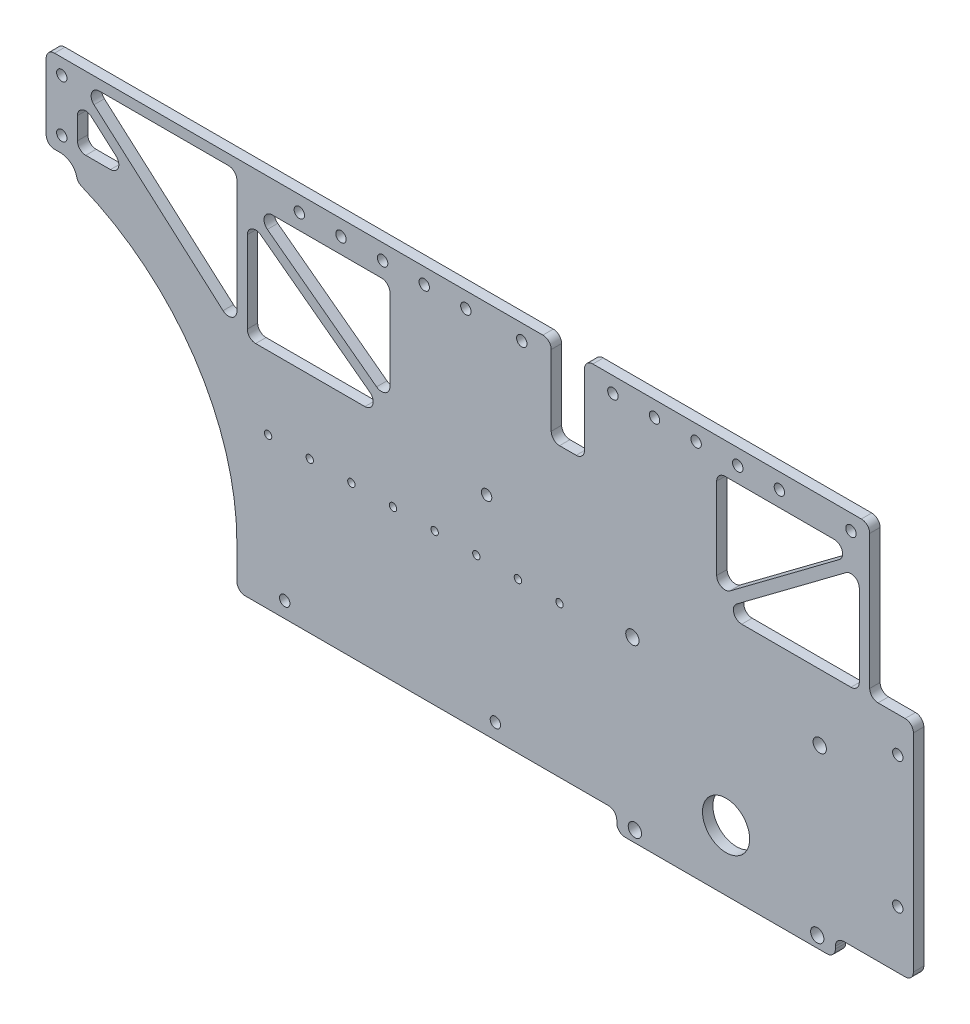
from build123d import *

# Parameters (mm, degrees)
SKETCH1_W            = 635
SKETCH1_H            = 136.525
SKETCH1_R            = 14.3891
BOSS_EXTRUDE1_DEPTH  = 6.35
SKETCH2_R            = 3.175
CUT_EXTRUDE1_DEPTH   = 325.817397019
SKETCH3_5_R          = 3.175
BOSS_EXTRUDE5_DEPTH  = 6.35
SKETCH4_W            = 40.57142
SKETCH4_H            = 44.2976
SKETCH4_R            = 4.064
SKETCH4_W_2          = 133.35
SKETCH4_H_2          = 18.0086
SKETCH4_W_3          = 18.415
SKETCH4_H_3          = 20.828
BOSS_EXTRUDE7_DEPTH  = 6.35
SKETCH5_R            = 4.064
SKETCH5_R_2          = 4.06539538
CUT_EXTRUDE3_DEPTH   = 328.465959643
FILLET1_R            = 5.08
FILLET2_R            = 3.175
SKETCH3_R            = 3.175
CUT_EXTRUDE4_DEPTH   = 328.465959643
FILLET4_R            = 3.175
SKETCH6_W            = 18.557078118
SKETCH6_H            = 39.949187225
BOSS_EXTRUDE8_DEPTH  = 6.35
SKETCH7_W            = 222.25
SKETCH7_H            = 154.673472586
CUT_EXTRUDE5_DEPTH   = 328.465959643
SKETCH8_W            = 6.35
SKETCH8_H            = 136.525
BOSS_EXTRUDE9_DEPTH  = 6.35
FILLET5_R            = 5.08
SKETCH9_R            = 3.175
BOSS_EXTRUDE10_DEPTH = 6.35
SKETCH10_R           = 3.175
CUT_EXTRUDE6_DEPTH   = 356.745254931
BOSS_EXTRUDE14_DEPTH = 6.35
BOSS_EXTRUDE16_DEPTH = 6.35
SKETCH12_W           = 15.83351873
SKETCH12_H           = 14.417925857
SKETCH12_W_2         = 19.64182
SKETCH12_H_2         = 108.78964543
SKETCH12_W_3         = 69.679335665
SKETCH12_H_3         = 12.817560459
SKETCH12_H_4         = 7.518606915
SKETCH12_W_4         = 6.576544335
SKETCH12_H_5         = 103.488832626
SKETCH12_W_5         = 3.175
SKETCH12_H_6         = 20.828
SKETCH12_W_6         = 5.08
SKETCH12_H_7         = 5.08
BOSS_EXTRUDE17_DEPTH = 6.35
SKETCH13_R           = 3.175
CUT_EXTRUDE7_DEPTH   = 356.745254931
CUT_EXTRUDE8_DEPTH   = 356.745254931
SKETCH15_W           = 20.32
SKETCH15_H           = 53.34
SKETCH15_W_2         = 79.983851964
SKETCH15_H_2         = 50.8
CUT_EXTRUDE9_DEPTH   = 356.745254931
FILLET8_R            = 5.08
SKETCH17_R           = 2.2479
CUT_EXTRUDE10_DEPTH  = 356.745255068


with BuildPart() as part:
    # Sketch1 → Boss-Extrude1 (new body)
    with BuildSketch(Plane.XY):
        Rectangle(SKETCH1_W, SKETCH1_H)
        with Locations((203.2, -42.8625)):
            Circle(SKETCH1_R, mode=Mode.SUBTRACT)
        with Locations((-206.82458, -42.8625)):
            Circle(SKETCH1_R, mode=Mode.SUBTRACT)
    extrude(amount=BOSS_EXTRUDE1_DEPTH)

    # Sketch2 → Cut-Extrude1 (cut, through all)
    with BuildSketch(Plane.XY.offset(6.35)):
        Polygon((-69.25818, -61.9125), (-186.08548, 53.005329912), (-186.08548, -61.9125), align=None)
        Polygon((-69.25818, 61.9125), (-186.08548, 61.9125), (-69.25818, -53.005329912), align=None)
        Polygon((-62.90818, -61.9125), (53.91912, -61.9125), (53.91912, 53.005329912), align=None)
        Polygon((53.91912, 61.9125), (-62.90818, 61.9125), (-62.90818, -53.005329912), align=None)
        Polygon((177.09642, -61.9125), (60.26912, 53.005329912), (60.26912, -61.9125), align=None)
        Polygon((177.09642, 61.9125), (60.26912, 61.9125), (177.09642, -53.005329912), align=None)
        with BuildLine():
            Line((257.81, -23.8125), (311.15, -23.8125))
            Line((311.15, -23.8125), (311.15, 37.823747319))
            ThreePointArc((311.15, 37.823747319), (306.727584277, 37.361038915), (302.577018199, 38.956238314))
            Line((302.577018199, 38.956238314), (257.81, -23.8125))
        make_face()
        with BuildLine():
            Line((306.218636269, 61.9125), (257.81, 61.9125))
            Line((257.81, 61.9125), (257.81, -12.876588851))
            Line((257.81, -12.876588851), (298.732456161, 44.501611558))
            ThreePointArc((298.732456161, 44.501611558), (299.949387671, 51.933834991), (306.183684914, 56.159045677))
            ThreePointArc((306.183684914, 56.159045677), (307.077151231, 56.515606037), (307.773939777, 57.17885793))
            Line((307.773939777, 57.17885793), (308.286575154, 57.897634323))
            ThreePointArc((308.286575154, 57.897634323), (308.47670611, 60.53556517), (306.218636269, 61.9125))
        make_face()
        Polygon((251.46, -12.876588851), (251.46, 61.9125), (206.848115361, 61.9125), align=None)
        Polygon((-311.15, -61.9125), (-227.56368, -61.9125), (-227.56368, 51.22616393), align=None)
        with BuildLine():
            ThreePointArc((-311.15, -13.414003587), (-302.592520369, -25.241870273), (-288.681380576, -20.813656454))
            Line((-288.681380576, -20.813656454), (-227.56368, 61.9125))
            Line((-227.56368, 61.9125), (-298.45, 61.9125))
            Line((-298.45, 61.9125), (-298.45, 46.80400344))
            ThreePointArc((-298.45, 46.80400344), (-302.475738686, 39.026873506), (-311.15, 37.823747319))
            Line((-311.15, 37.823747319), (-311.15, -13.414003587))
        make_face()
        with Locations((-307.975, -33.3375)):
            Circle(SKETCH2_R)
        with Locations((307.975, -33.3375)):
            Circle(SKETCH2_R)
        with Locations((-307.975, 46.80400344)):
            Circle(SKETCH2_R)
        with Locations((307.975, 46.80400344)):
            Circle(SKETCH2_R)
    extrude(amount=-CUT_EXTRUDE1_DEPTH, mode=Mode.SUBTRACT)

    # Sketch3<5> → Boss-Extrude5 (add)
    with BuildSketch(Plane.XY.offset(6.35)):
        with BuildLine():
            ThreePointArc((52.9336, -58.7375), (62.4586, -49.2125), (71.9836, -58.7375))
            Line((71.9836, -58.7375), (71.9836, -68.2625))
            Line((71.9836, -68.2625), (52.9336, -68.2625))
            Line((52.9336, -68.2625), (52.9336, -58.7375))
        make_face()
        with Locations((62.4586, -58.7375)):
            Circle(SKETCH3_5_R, mode=Mode.SUBTRACT)
    extrude(amount=-BOSS_EXTRUDE5_DEPTH)

    # Sketch4 → Boss-Extrude7 (add, through all)
    # profile 1 of 3: a face of its own
    with BuildSketch(Plane.XY.offset(6.35)):
        with Locations((156.81071, 39.7637)):
            Rectangle(SKETCH4_W, SKETCH4_H)
        with Locations((146.05, 28.0289)):
            Circle(SKETCH4_R, mode=Mode.SUBTRACT)
    # profile 2 of 3: a face of its own
    with BuildSketch(Plane.XY.offset(6.35)):
        with Locations((203.2, -70.9168)):
            Rectangle(SKETCH4_W_2, SKETCH4_H_2)
        with Locations((147.574, -73.0631)):
            Circle(SKETCH4_R, mode=Mode.SUBTRACT)
        with Locations((258.826, -73.0631)):
            Circle(SKETCH4_R, mode=Mode.SUBTRACT)
    # profile 3 of 3: a face of its own
    with BuildSketch(Plane.XY.offset(6.35)):
        with Locations((260.6675, 28.0289)):
            Rectangle(SKETCH4_W_3, SKETCH4_H_3)
        with Locations((260.35, 28.0289)):
            Circle(SKETCH4_R, mode=Mode.SUBTRACT)
    extrude(amount=-BOSS_EXTRUDE7_DEPTH)

    # Sketch5 → Cut-Extrude3 (cut, through all)
    with BuildSketch(Plane.XY.offset(6.35)):
        with Locations((146.05, 28.0289)):
            Circle(SKETCH5_R)
        with Locations((260.35, 28.0289)):
            Circle(SKETCH5_R_2)
    extrude(amount=-CUT_EXTRUDE3_DEPTH, mode=Mode.SUBTRACT)

    # Fillet1
    # the kernel refuses this fillet: 5.08 mm, written as the material it adds along each edge
    with BuildSketch(Plane(origin=(206.848115361, 61.9125, 6.35), x_dir=(0.512285493474542, -0.8588152148020813, 0), z_dir=(0, 0, -1))) as fillet1_piece_1:
        with BuildLine():
            CenterArc((FILLET1_R * 1.76089741706, -FILLET1_R), FILLET1_R, 90, 120.816185582)
            Line((FILLET1_R * 0.902082202255, -FILLET1_R * 1.51228549347), (0, 0))
            Line((0, 0), (FILLET1_R * 1.76089741706, 0))
        make_face()
    extrude(amount=6.35)
    with BuildSketch(Plane(origin=(251.46, 61.9125, 6.35), x_dir=(0, -1, 0), z_dir=(0, 0, -1)), Plane(origin=(257.81, 61.9125, 6.35), x_dir=(1, 0, 0), z_dir=(0, 0, -1)), Plane(origin=(136.525, 61.9125, 6.35), x_dir=(0, -1, 0), z_dir=(0, 0, -1)), Plane(origin=(177.09642, 17.6149, 6.35), x_dir=(0, -1, 0), z_dir=(0, 0, -1)), Plane(origin=(-227.56368, -61.9125, 6.35), x_dir=(-1, 0, 0), z_dir=(0, 0, -1)), Plane(origin=(-186.08548, -61.9125, 6.35), x_dir=(0, 1, 0), z_dir=(0, 0, -1)), Plane(origin=(-62.90818, 61.9125, 6.35), x_dir=(1, 0, 0), z_dir=(0, 0, -1))) as fillet1_piece_2:
        with BuildLine():
            CenterArc((FILLET1_R, FILLET1_R), FILLET1_R, 180, 90)
            Line((0, FILLET1_R), (0, 0))
            Line((0, 0), (FILLET1_R, 0))
        make_face()
    extrude(amount=6.35)
    with BuildSketch(Plane(origin=(251.46, -12.876588851, 6.35), x_dir=(0, 1, 0), z_dir=(0, 0, -1))) as fillet1_piece_3:
        with BuildLine():
            CenterArc((FILLET1_R * 3.62847521251, -FILLET1_R), FILLET1_R, 90, 149.183814418)
            Line((FILLET1_R * 3.11618971904, -FILLET1_R * 1.8588152148), (0, 0))
            Line((0, 0), (FILLET1_R * 3.62847521251, 0))
        make_face()
    extrude(amount=6.35)
    with BuildSketch(Plane(origin=(298.732456161, 44.501611558, 6.35), x_dir=(-0.156449292900934, 0.9876859919786236, 0), z_dir=(0, 0, -1))) as fillet1_piece_4:
        with BuildLine():
            CenterArc((2.097728596, -5.060767287), FILLET1_R, 94.987273308, 39.51026668)
            Line((-1.462734895, -1.437302132), (0, 0))
            ThreePointArc((0, 0), (0.828050762, -0.036061338), (1.656101523, 0))
        make_face()
    extrude(amount=6.35)
    with BuildSketch(Plane(origin=(257.81, -12.876588851, 6.35), x_dir=(0.58065577834663, 0.8141491675808981, 0), z_dir=(0, 0, -1))) as fillet1_piece_5:
        with BuildLine():
            CenterArc((FILLET1_R * 3.12431088303, -FILLET1_R), FILLET1_R, 90, 144.503320177)
            Line((FILLET1_R * 2.54365510468, -FILLET1_R * 1.81414916758), (0, 0))
            Line((0, 0), (FILLET1_R * 3.12431088303, 0))
        make_face()
    extrude(amount=6.35)
    with BuildSketch(Plane(origin=(302.577018199, 38.956238314, 6.35), x_dir=(0.9100185718572312, -0.4145674841023176, 0), z_dir=(0, 0, -1))) as fillet1_piece_6:
        with BuildLine():
            CenterArc((4.202383129, 5.002367865), FILLET1_R, 191.00459797, 68.96585853)
            Line((-0.78420516, 4.032657993), (0, 0))
            ThreePointArc((0, 0), (1.658835446, 0.145560253), (3.317670892, 0))
        make_face()
    extrude(amount=6.35)
    with BuildSketch(Plane(origin=(311.15, 37.823747319, 6.35), x_dir=(-0.9945433078574452, -0.10432453592502183, 0), z_dir=(0, 0, -1))) as fillet1_piece_7:
        with BuildLine():
            CenterArc((5.626062007, -4.939991482), FILLET1_R, 103.482969045, 82.505282546)
            Line((0.573782003, -5.469960125), (0, 0))
            ThreePointArc((0, 0), (2.22081395, -0.26251597), (4.4416279, 0))
        make_face()
    extrude(amount=6.35)
    with BuildSketch(Plane(origin=(311.15, -23.8125, 6.35), x_dir=(0, 1, 0), z_dir=(0, 0, -1)), Plane(origin=(-298.45, 61.9125, 6.35), x_dir=(0, -1, 0), z_dir=(0, 0, -1)), Plane(origin=(136.525, -68.2625, 6.35), x_dir=(-1, 0, 0), z_dir=(0, 0, -1)), Plane(origin=(269.875, -68.2625, 0), x_dir=(1, 0, 0), z_dir=(0, 0, 1)), Plane(origin=(-69.25818, 61.9125, 6.35), x_dir=(-1, 0, 0), z_dir=(0, 0, -1))) as fillet1_piece_8:
        with BuildLine():
            CenterArc((FILLET1_R, -FILLET1_R), FILLET1_R, 90, 90)
            Line((0, -FILLET1_R), (0, 0))
            Line((0, 0), (FILLET1_R, 0))
        make_face()
    extrude(amount=6.35)
    with BuildSketch(Plane(origin=(257.81, -23.8125, 6.35), x_dir=(0.5806557783466294, 0.8141491675808985, 0), z_dir=(0, 0, -1))) as fillet1_piece_9:
        with BuildLine():
            CenterArc((FILLET1_R * 1.94148178404, FILLET1_R), FILLET1_R, 144.503320177, 125.496679823)
            Line((FILLET1_R * 1.12733261646, FILLET1_R * 1.58065577835), (0, 0))
            Line((0, 0), (FILLET1_R * 1.94148178404, 0))
        make_face()
    extrude(amount=6.35)
    with BuildSketch(Plane(origin=(-311.15, 37.823747319, 6.35), x_dir=(0, -1, 0), z_dir=(0, 0, -1))) as fillet1_piece_10:
        with BuildLine():
            CenterArc((5.499971778, -5.08), FILLET1_R, 90, 82.505282546)
            ThreePointArc((0.463370769, -4.417391304), (0.492768886, -2.181308795), (0, 0))
            Line((0, 0), (5.499971778, 0))
        make_face()
    extrude(amount=6.35)
    with BuildSketch(Plane(origin=(-227.56368, 61.9125, 6.35), x_dir=(-0.5942167604191997, -0.8043049431881613, 0), z_dir=(0, 0, -1)), Plane(origin=(-311.15, -61.9125, 6.35), x_dir=(0.5942167604191981, 0.8043049431881626, 0), z_dir=(0, 0, -1))) as fillet1_piece_11:
        with BuildLine():
            CenterArc((FILLET1_R * 1.98210488935, FILLET1_R), FILLET1_R, 143.543183154, 126.456816846)
            Line((FILLET1_R * 1.17779994616, FILLET1_R * 1.59421676042), (0, 0))
            Line((0, 0), (FILLET1_R * 1.98210488935, 0))
        make_face()
    extrude(amount=6.35)
    with BuildSketch(Plane(origin=(71.9836, -61.9125, 6.35), x_dir=(1, 0, 0), z_dir=(0, 0, -1)), Plane(origin=(52.9336, -61.9125, 0), x_dir=(-1, 0, 0), z_dir=(0, 0, 1))) as fillet1_piece_12:
        with BuildLine():
            CenterArc((4.955227899, -5.08), FILLET1_R, 90, 82.505282546)
            Line((-0.08137311, -4.417391304), (-0.58503321, -4.351130435))
            ThreePointArc((-0.58503321, -4.351130435), (-0.508, -3.175), (-0.508, 0))
            Line((-0.508, 0), (0, 0.508))
            Line((0, 0.508), (4.955227899, 0.508))
            Line((4.955227899, 0.508), (4.955227899, 0))
        make_face()
    extrude(amount=6.35)
    with BuildSketch(Plane(origin=(60.26912, -49.467559206, 0), x_dir=(0.9998662412607702, 0.016355414609833863, 0), z_dir=(0, 0, 1))) as fillet1_piece_13:
        with BuildLine():
            CenterArc((5.161852646, 4.962405713), FILLET1_R, 179.062861987, 78.58505404)
            Line((0.08253214, 5.045491219), (0, 0))
            ThreePointArc((0, 0), (2.037573413, 0.220489288), (4.075146826, 0))
        make_face()
    extrude(amount=6.35)
    with BuildSketch(Plane(origin=(-227.56368, 51.22616393, 6.35), x_dir=(-0.5942167604191995, -0.8043049431881615, 0), z_dir=(0, 0, -1))) as fillet1_piece_14:
        with BuildLine():
            CenterArc((FILLET1_R * 3.0364423614, -FILLET1_R), FILLET1_R, 90, 143.543183154)
            Line((FILLET1_R * 2.44222560098, -FILLET1_R * 1.80430494319), (0, 0))
            Line((0, 0), (FILLET1_R * 3.0364423614, 0))
        make_face()
    extrude(amount=6.35)
    with BuildSketch(Plane(origin=(-69.25818, -53.005329912, 6.35), x_dir=(-0.7129088068865802, 0.7012567525974724, 0), z_dir=(0, 0, -1)), Plane(origin=(-186.08548, 53.005329912, 6.35), x_dir=(0.7129088068865791, -0.7012567525974737, 0), z_dir=(0, 0, -1)), Plane(origin=(60.26912, 53.005329912, 6.35), x_dir=(0.7129088068865802, -0.7012567525974724, 0), z_dir=(0, 0, -1)), Plane(origin=(-62.90818, -53.005329912, 6.35), x_dir=(0, 1, 0), z_dir=(0, 0, -1))) as fillet1_piece_15:
        with BuildLine():
            CenterArc((FILLET1_R * 2.38635956824, FILLET1_R), FILLET1_R, 135.472079398, 134.527920602)
            Line((FILLET1_R * 1.67345076135, FILLET1_R * 1.7012567526), (0, 0))
            Line((0, 0), (FILLET1_R * 2.38635956824, 0))
        make_face()
    extrude(amount=6.35)
    with BuildSketch(Plane(origin=(-186.08548, 61.9125, 6.35), x_dir=(1, 0, 0), z_dir=(0, 0, -1)), Plane(origin=(177.09642, -61.9125, 6.35), x_dir=(-1, 0, 0), z_dir=(0, 0, -1))) as fillet1_piece_16:
        with BuildLine():
            CenterArc((FILLET1_R * 2.44262718404, FILLET1_R), FILLET1_R, 134.527920602, 135.472079398)
            Line((FILLET1_R * 1.74137043144, FILLET1_R * 1.71290880689), (0, 0))
            Line((0, 0), (FILLET1_R * 2.44262718404, 0))
        make_face()
    extrude(amount=6.35)
    with BuildSketch(Plane(origin=(-69.25818, -61.9125, 6.35), x_dir=(-0.7129088068865801, 0.7012567525974727, 0), z_dir=(0, 0, -1)), Plane(origin=(-62.90818, -61.9125, 6.35), x_dir=(1, 0, 0), z_dir=(0, 0, -1)), Plane(origin=(60.26912, 61.9125, 6.35), x_dir=(0.7129088068865803, -0.7012567525974723, 0), z_dir=(0, 0, -1)), Plane(origin=(53.91912, 61.9125, 6.35), x_dir=(-1, 0, 0), z_dir=(0, 0, -1))) as fillet1_piece_17:
        with BuildLine():
            CenterArc((FILLET1_R * 2.44262718404, -FILLET1_R), FILLET1_R, 90, 135.472079398)
            Line((FILLET1_R * 1.74137043144, -FILLET1_R * 1.71290880689), (0, 0))
            Line((0, 0), (FILLET1_R * 2.44262718404, 0))
        make_face()
    extrude(amount=6.35)
    with BuildSketch(Plane(origin=(53.91912, 53.005329912, 6.35), x_dir=(-0.7129088068865802, -0.7012567525974724, 0), z_dir=(0, 0, -1)), Plane(origin=(177.09642, -53.005329912, 6.35), x_dir=(0, 1, 0), z_dir=(0, 0, -1))) as fillet1_piece_18:
        with BuildLine():
            CenterArc((FILLET1_R * 2.38635956824, -FILLET1_R), FILLET1_R, 90, 134.527920602)
            Line((FILLET1_R * 1.67345076135, -FILLET1_R * 1.7012567526), (0, 0))
            Line((0, 0), (FILLET1_R * 2.38635956824, 0))
        make_face()
    extrude(amount=6.35)
    # the kernel refuses this fillet: 5.08 mm, written as the material it takes off along each edge
    with BuildSketch(Plane(origin=(136.525, 17.6149, 19.05), x_dir=(1, 0, 0), z_dir=(0, 0, -1)), Plane(origin=(-317.5, -68.2625, -12.7), x_dir=(0, 1, 0), z_dir=(0, 0, 1)), Plane(origin=(-317.5, 68.2625, -12.7), x_dir=(1, 0, 0), z_dir=(0, 0, 1))) as fillet1_2_piece_1:
        with BuildLine():
            CenterArc((FILLET1_R, -FILLET1_R), FILLET1_R, 90, 90)
            Line((0, -FILLET1_R), (0, 0))
            Line((0, 0), (FILLET1_R, 0))
        make_face()
    extrude(amount=31.75, mode=Mode.SUBTRACT)
    with BuildSketch(Plane(origin=(136.525, -79.9211, 19.05), x_dir=(0, 1, 0), z_dir=(0, 0, -1)), Plane(origin=(269.875, -79.9211, 19.05), x_dir=(-1, 0, 0), z_dir=(0, 0, -1)), Plane(origin=(317.5, -68.2625, -12.7), x_dir=(0, 1, 0), z_dir=(0, 0, 1))) as fillet1_2_piece_2:
        with BuildLine():
            CenterArc((FILLET1_R, FILLET1_R), FILLET1_R, 180, 90)
            Line((0, FILLET1_R), (0, 0))
            Line((0, 0), (FILLET1_R, 0))
        make_face()
    extrude(amount=31.75, mode=Mode.SUBTRACT)

    # Fillet2
    fillet2_edges = [part.edges().sort_by_distance(p)[0] for p in [
        (257.81, 38.4429, 3.175),
        (257.81, 17.6149, 3.175),
    ]]
    fillet(fillet2_edges, radius=FILLET2_R)

    # Sketch3 → Cut-Extrude4 (cut, through all)
    with BuildSketch(Plane.XY.offset(6.35)):
        with Locations((-66.08318, -58.7375)):
            Circle(SKETCH3_R)
        with BuildLine():
            ThreePointArc((60.26912, -61.036804749), (63.709404941, -61.655737824), (65.6336, -58.7375))
            ThreePointArc((65.6336, -58.7375), (63.709404941, -55.819262176), (60.26912, -56.438195251))
            Line((60.26912, -56.438195251), (60.26912, -61.036804749))
        make_face()
        with BuildLine():
            Line((60.26912, -61.036804749), (60.26912, -56.438195251))
            ThreePointArc((60.26912, -56.438195251), (59.2836, -58.7375), (60.26912, -61.036804749))
        make_face()
    extrude(amount=-CUT_EXTRUDE4_DEPTH, mode=Mode.SUBTRACT)

    # Fillet4
    fillet4_edges = [part.edges().sort_by_distance(p)[0] for p in [
        (269.875, 17.6149, 3.175),
        (269.875, 38.4429, 3.175),
    ]]
    fillet(fillet4_edges, radius=FILLET4_R)

    # Sketch6 → Boss-Extrude8 (add)
    with BuildSketch(Plane.XY.offset(6.35)):
        with Locations((191.663943851, 44.016225807)):
            Rectangle(SKETCH6_W, SKETCH6_H)
    extrude(amount=-BOSS_EXTRUDE8_DEPTH)

    # Sketch7 → Cut-Extrude5 (cut, through all)
    with BuildSketch(Plane.XY.offset(6.35)):
        with Locations((-206.375, 5.039646722)):
            Rectangle(SKETCH7_W, SKETCH7_H)
    extrude(amount=-CUT_EXTRUDE5_DEPTH, mode=Mode.SUBTRACT)

    # Sketch8 → Boss-Extrude9 (add)
    with BuildSketch(Plane.XY.offset(6.35)):
        with Locations((-92.075, 0)):
            Rectangle(SKETCH8_W, SKETCH8_H)
    extrude(amount=-BOSS_EXTRUDE9_DEPTH)

    # Fillet5
    fillet5_edges = [part.edges().sort_by_distance(p)[0] for p in [
        (53.91912, -54.518150959, 3.175),
        (-95.25, -68.2625, 3.175),
        (-88.9, 61.9125, 3.175),
        (-88.9, -61.9125, 3.175),
        (-88.9, -42.591713421, 3.175),
        (-88.9, -33.684543333, 3.175),
    ]]
    fillet(fillet5_edges, radius=FILLET5_R)

    # Sketch9 → Boss-Extrude10 (add)
    with BuildSketch(Plane.XY.offset(6.35)):
        Polygon((-95.25, 160.3375), (-95.25, 68.2625), (-88.9, 68.2625), (-88.9, 133.356656075), (-1.905, 68.2625), (197.485, 68.2625), (284.48, 133.356656075), (284.48, 68.2625), (290.83, 68.2625), (290.83, 160.3375), align=None)
        Polygon((-1.905, 76.193343925), (-88.9, 141.2875), (-1.905, 141.2875), align=None, mode=Mode.SUBTRACT)
        Polygon((197.485, 76.193343925), (197.485, 141.2875), (284.48, 141.2875), align=None, mode=Mode.SUBTRACT)
        with Locations((-57.15, 150.8125)):
            Circle(SKETCH9_R, mode=Mode.SUBTRACT)
        with Locations((-31.75, 150.8125)):
            Circle(SKETCH9_R, mode=Mode.SUBTRACT)
        with Locations((-6.35, 150.8125)):
            Circle(SKETCH9_R, mode=Mode.SUBTRACT)
        with Locations((19.05, 150.8125)):
            Circle(SKETCH9_R, mode=Mode.SUBTRACT)
        with Locations((44.45, 150.8125)):
            Circle(SKETCH9_R, mode=Mode.SUBTRACT)
        with Locations((279.4, 150.8125)):
            Circle(SKETCH9_R, mode=Mode.SUBTRACT)
    extrude(amount=-BOSS_EXTRUDE10_DEPTH)

    # Sketch10 → Cut-Extrude6 (cut, through all)
    with BuildSketch(Plane.XY.offset(6.35)):
        with Locations((57.09412, 58.7375)):
            Circle(SKETCH10_R)
    extrude(amount=-CUT_EXTRUDE6_DEPTH, mode=Mode.SUBTRACT)

    # Sketch11 → Boss-Extrude14 (add)
    with BuildSketch(Plane(origin=(0, 0, 0), x_dir=(-1, 0, 0), z_dir=(0, 0, -1))):
        with BuildLine():
            Line((291.592, 109.5375), (291.592, 160.3375))
            Line((291.592, 160.3375), (95.25, 160.3375))
            Line((95.25, 160.3375), (95.25, -42.8625))
            ThreePointArc((95.25, -42.8625), (139.886926547, 64.900573453), (247.65, 109.5375))
            Line((247.65, 109.5375), (291.592, 109.5375))
        make_face()
    extrude(amount=-BOSS_EXTRUDE14_DEPTH)

    # Sketch2<3> → Boss-Extrude16 (add)
    with BuildSketch(Plane.XY.offset(6.35)):
        Polygon((-62.90818, 61.9125), (-62.90818, -53.005329912), (53.91912, 61.9125), align=None)
        Polygon((-62.90818, -61.9125), (53.91912, 53.005329912), (53.91912, -61.9125), align=None)
        Polygon((206.848115361, 61.9125), (251.46, 61.9125), (251.46, -12.876588851), align=None)
        with BuildLine():
            ThreePointArc((302.577018199, 38.956238314), (306.727584277, 37.361038915), (311.15, 37.823747319))
            Line((311.15, 37.823747319), (311.15, -23.8125))
            Line((311.15, -23.8125), (257.81, -23.8125))
            Line((257.81, -23.8125), (302.577018199, 38.956238314))
        make_face()
    extrude(amount=-BOSS_EXTRUDE16_DEPTH)

    # Sketch12 → Boss-Extrude17 (add)
    with BuildSketch(Plane.XY.offset(6.35)):
        with Locations((-83.111621925, -55.986936692)):
            Rectangle(SKETCH12_W, SKETCH12_H)
        with Locations((-79.07909, 7.517677285)):
            Rectangle(SKETCH12_W_2, SKETCH12_H_2)
        Polygon((136.525, 49.094939541), (66.845664335, 49.094939541), (66.845664335, -54.393893085), (136.525, -54.393893085), (136.525, 17.6149), (136.525, 22.6949), align=None)
        Polygon((136.525, 17.6149), (136.525, -54.393893085), (136.525, -61.9125), (177.09642, -61.9125), (177.09642, 17.6149), (141.605, 17.6149), align=None)
        with Locations((101.685332168, 55.50371977)):
            Rectangle(SKETCH12_W_3, SKETCH12_H_3)
        with Locations((101.685332168, -58.153196542)):
            Rectangle(SKETCH12_W_3, SKETCH12_H_4)
        with Locations((63.557392168, -2.649476772)):
            Rectangle(SKETCH12_W_4, SKETCH12_H_5)
        Polygon((257.81, 38.4429), (257.81, 61.9125), (311.15, 61.9125), (257.81, -12.876588851), (257.81, 17.6149), (269.875, 17.6149), (269.875, 38.4429), align=None)
        with Locations((268.2875, 28.0289)):
            Rectangle(SKETCH12_W_5, SKETCH12_H_6)
        with Locations((139.065, 20.1549)):
            Rectangle(SKETCH12_W_6, SKETCH12_H_7)
    extrude(amount=-BOSS_EXTRUDE17_DEPTH)

    # Sketch13 → Cut-Extrude7 (cut, through all)
    with BuildSketch(Plane.XY.offset(6.35)):
        with Locations((-202.083148036, 150.8125)):
            Circle(SKETCH13_R)
        with Locations((-202.083148036, 119.0625)):
            Circle(SKETCH13_R)
        with Locations((78.58125, 150.8125)):
            Circle(SKETCH13_R)
        with Locations((235.74375, 150.8125)):
            Circle(SKETCH13_R)
        with Locations((210.34375, 150.8125)):
            Circle(SKETCH13_R)
        with Locations((184.94375, 150.8125)):
            Circle(SKETCH13_R)
        with Locations((159.54375, 150.8125)):
            Circle(SKETCH13_R)
        with Locations((134.14375, 150.8125)):
            Circle(SKETCH13_R)
        Polygon((-95.25, 153.9875), (-95.25, 68.2625), (-192.558148036, 153.9875), align=None)
        Polygon((-192.558148036, 145.524834211), (-158.916222054, 115.8875), (-192.558148036, 115.8875), align=None)
    extrude(amount=-CUT_EXTRUDE7_DEPTH, mode=Mode.SUBTRACT)

    # Sketch14 → Cut-Extrude8 (cut, through all)
    with BuildSketch(Plane.XY.offset(6.35)):
        with BuildLine():
            Line((-202.946, 109.5375), (-247.65, 109.5375))
            ThreePointArc((-247.65, 109.5375), (-225.048054367, 107.852170996), (-202.946, 102.833458709))
            Line((-202.946, 102.833458709), (-202.946, 109.5375))
        make_face()
        with BuildLine():
            ThreePointArc((-202.946, 109.5375), (-195.694892846, 106.533993075), (-192.69138592, 99.28288592))
            Line((-192.69138592, 99.28288592), (-202.946, 99.28288592))
            Line((-202.946, 99.28288592), (-202.946, 102.833458709))
            Line((-202.946, 102.833458709), (-202.946, 109.5375))
        make_face()
    extrude(amount=-CUT_EXTRUDE8_DEPTH, mode=Mode.SUBTRACT)

    # Sketch15 → Cut-Extrude9 (cut, through all)
    with BuildSketch(Plane.XY.offset(6.35)):
        with Locations((106.68, 133.6675)):
            Rectangle(SKETCH15_W, SKETCH15_H)
        with Locations((-251.600074018, 134.9375)):
            Rectangle(SKETCH15_W_2, SKETCH15_H_2)
    extrude(amount=-CUT_EXTRUDE9_DEPTH, mode=Mode.SUBTRACT)

    # Fillet8
    fillet8_edges = [part.edges().sort_by_distance(p)[0] for p in [
        (-192.558148036, 115.8875, 3.175),
        (-192.558148036, 145.524834211, 3.175),
        (-158.916222054, 115.8875, 3.175),
        (-192.558148036, 153.9875, 3.175),
        (-95.25, 153.9875, 3.175),
        (-95.25, 68.2625, 3.175),
        (-192.69138592, 99.28288592, 3.175),
        (96.52, 106.9975, 3.175),
        (96.52, 160.3375, 3.175),
        (116.84, 160.3375, 3.175),
        (116.84, 106.9975, 3.175),
        (-211.608148036, 160.3375, 3.175),
        (-211.608148036, 109.5375, 3.175),
        (317.5, 68.2625, 3.175),
        (197.485, 76.193343925, 3.175),
        (284.48, 141.2875, 3.175),
        (-1.905, 76.193343925, 3.175),
        (-1.905, 141.2875, 3.175),
        (284.48, 133.356656075, 3.175),
        (197.485, 68.2625, 3.175),
        (-1.905, 68.2625, 3.175),
        (-88.9, 133.356656075, 3.175),
        (-88.9, 68.2625, 3.175),
        (290.83, 160.3375, 3.175),
        (290.83, 68.2625, 3.175),
        (197.485, 141.2875, 3.175),
        (-88.9, 141.2875, 3.175),
        (284.48, 68.2625, 3.175),
    ]]
    fillet(fillet8_edges, radius=FILLET8_R)

    # Sketch17 → Cut-Extrude10 (cut, through all)
    with BuildSketch(Plane.XY.offset(6.35)):
        with Locations((50.8, 23.8125)):
            Circle(SKETCH17_R)
        with Locations((76.2, 23.8125)):
            Circle(SKETCH17_R)
        with Locations((101.6, 23.8125)):
            Circle(SKETCH17_R)
        with Locations((25.4, 23.8125)):
            Circle(SKETCH17_R)
        with Locations((0, 23.8125)):
            Circle(SKETCH17_R)
        with Locations((-25.4, 23.8125)):
            Circle(SKETCH17_R)
        with Locations((-50.8, 23.8125)):
            Circle(SKETCH17_R)
        with Locations((-76.2, 23.8125)):
            Circle(SKETCH17_R)
    extrude(amount=-CUT_EXTRUDE10_DEPTH, mode=Mode.SUBTRACT)


solid = part.part
